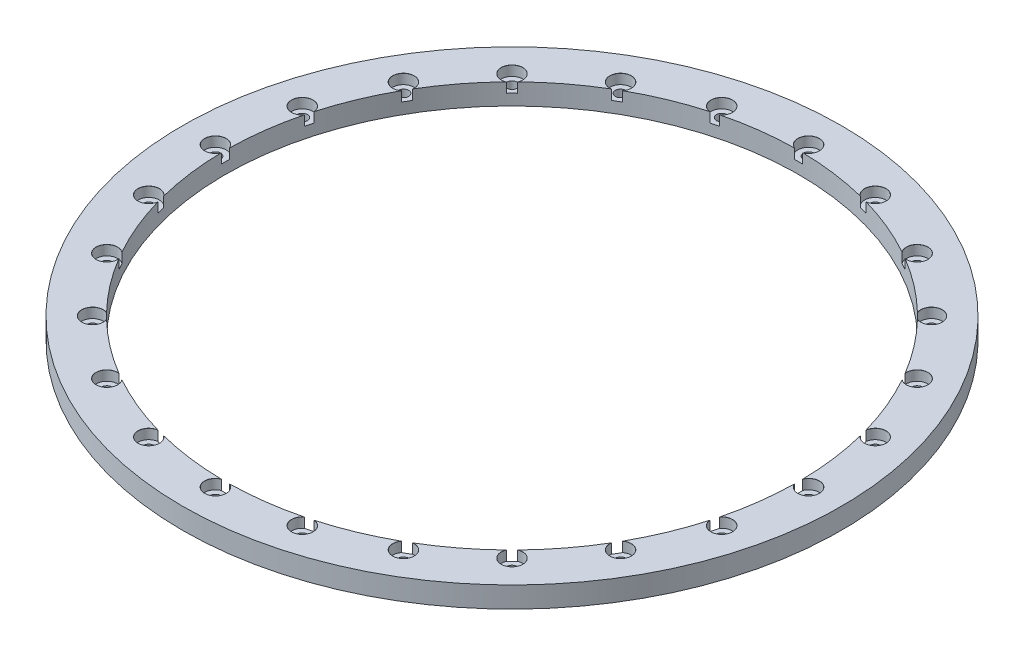
from build123d import *

# Parameters (mm, degrees)
SKETCH1_R                      = 100
SKETCH1_R_2                    = 87
BOSS_EXTRUDE1_DEPTH            = 6.35
CBORE_FOR_M3_SHCS1_AT_2_COUNT  = 2
CBORE_FOR_M3_SHCS1_AT_2_PITCH  = 23.4947146
CBORE_FOR_M3_SHCS1_AT_3_COUNT  = 2
CBORE_FOR_M3_SHCS1_AT_3_PITCH  = 46.587428118
CBORE_FOR_M3_SHCS1_AT_4_COUNT  = 2
CBORE_FOR_M3_SHCS1_AT_4_PITCH  = 68.883017826
CBORE_FOR_M3_SHCS1_AT_5_COUNT  = 2
CBORE_FOR_M3_SHCS1_AT_5_PITCH  = 90
CBORE_FOR_M3_SHCS1_AT_6_COUNT  = 2
CBORE_FOR_M3_SHCS1_AT_6_PITCH  = 109.577057222
CBORE_FOR_M3_SHCS1_AT_7_COUNT  = 2
CBORE_FOR_M3_SHCS1_AT_7_PITCH  = 127.279220614
CBORE_FOR_M3_SHCS1_AT_8_COUNT  = 2
CBORE_FOR_M3_SHCS1_AT_8_PITCH  = 142.803601252
CBORE_FOR_M3_SHCS1_AT_9_COUNT  = 2
CBORE_FOR_M3_SHCS1_AT_9_PITCH  = 155.884572681
CBORE_FOR_M3_SHCS1_AT_10_COUNT = 2
CBORE_FOR_M3_SHCS1_AT_10_PITCH = 166.298315852
CBORE_FOR_M3_SHCS1_AT_11_COUNT = 2
CBORE_FOR_M3_SHCS1_AT_11_PITCH = 173.866648732
CBORE_FOR_M3_SHCS1_AT_12_COUNT = 2
CBORE_FOR_M3_SHCS1_AT_12_PITCH = 178.460075047
CBORE_FOR_M3_SHCS1_AT_13_COUNT = 2
CBORE_FOR_M3_SHCS1_AT_13_PITCH = 180
CBORE_FOR_M3_SHCS1_AT_14_COUNT = 2
CBORE_FOR_M3_SHCS1_AT_14_PITCH = 178.460075047
CBORE_FOR_M3_SHCS1_AT_15_COUNT = 2
CBORE_FOR_M3_SHCS1_AT_15_PITCH = 173.866648732
CBORE_FOR_M3_SHCS1_AT_16_COUNT = 2
CBORE_FOR_M3_SHCS1_AT_16_PITCH = 166.298315852
CBORE_FOR_M3_SHCS1_AT_17_COUNT = 2
CBORE_FOR_M3_SHCS1_AT_17_PITCH = 155.884572681
CBORE_FOR_M3_SHCS1_AT_18_COUNT = 2
CBORE_FOR_M3_SHCS1_AT_18_PITCH = 142.803601252
CBORE_FOR_M3_SHCS1_AT_19_COUNT = 2
CBORE_FOR_M3_SHCS1_AT_19_PITCH = 127.279220614
CBORE_FOR_M3_SHCS1_AT_20_COUNT = 2
CBORE_FOR_M3_SHCS1_AT_20_PITCH = 109.577057222
CBORE_FOR_M3_SHCS1_AT_21_COUNT = 2
CBORE_FOR_M3_SHCS1_AT_21_PITCH = 90
CBORE_FOR_M3_SHCS1_AT_22_COUNT = 2
CBORE_FOR_M3_SHCS1_AT_22_PITCH = 68.883017826
CBORE_FOR_M3_SHCS1_AT_23_COUNT = 2
CBORE_FOR_M3_SHCS1_AT_23_PITCH = 46.587428118
CBORE_FOR_M3_SHCS1_AT_24_COUNT = 2
CBORE_FOR_M3_SHCS1_AT_24_PITCH = 23.4947146


with BuildPart() as part:
    # Sketch1 → Boss-Extrude1 (new body)
    with BuildSketch(Plane(origin=(0, 0, 0), x_dir=(1, 0, 0), z_dir=(0, 1, 0))):
        Circle(SKETCH1_R)
        Circle(SKETCH1_R_2, mode=Mode.SUBTRACT)
    extrude(amount=BOSS_EXTRUDE1_DEPTH)

    # Sketch3 → CBORE for M3 SHCS1 (revolve, cut)
    with BuildSketch(Plane(origin=(90, 6.35, 0), x_dir=(0, 0, 1), z_dir=(1, 0, 0))):
        Polygon((0, 0), (0, 6.35), (1.6, 6.35), (1.6, 3), (3.25, 3), (3.25, 0.025), (3.275, 0), align=None)
    cbore_for_m3_shcs1 = revolve(axis=Axis((90, 12.7, 0), (0, -1, 0)), mode=Mode.SUBTRACT)

    # CBORE for M3 SHCS1 at 2: CBORE for M3 SHCS1 ×2
    with Locations(*[Vector(-0.13052619222005138, 0, 0.9914448613738105) * (i * CBORE_FOR_M3_SHCS1_AT_2_PITCH) for i in range(1, CBORE_FOR_M3_SHCS1_AT_2_COUNT)]):
        add(cbore_for_m3_shcs1, mode=Mode.SUBTRACT)

    # CBORE for M3 SHCS1 at 3: CBORE for M3 SHCS1 ×2
    with Locations(*[Vector(-0.25881904510252074, 0, 0.9659258262890683) * (i * CBORE_FOR_M3_SHCS1_AT_3_PITCH) for i in range(1, CBORE_FOR_M3_SHCS1_AT_3_COUNT)]):
        add(cbore_for_m3_shcs1, mode=Mode.SUBTRACT)

    # CBORE for M3 SHCS1 at 4: CBORE for M3 SHCS1 ×2
    with Locations(*[Vector(-0.3826834323650899, 0, 0.9238795325112867) * (i * CBORE_FOR_M3_SHCS1_AT_4_PITCH) for i in range(1, CBORE_FOR_M3_SHCS1_AT_4_COUNT)]):
        add(cbore_for_m3_shcs1, mode=Mode.SUBTRACT)

    # CBORE for M3 SHCS1 at 5: CBORE for M3 SHCS1 ×2
    with Locations(*[Vector(-0.5000000000000001, 0, 0.8660254037844386) * (i * CBORE_FOR_M3_SHCS1_AT_5_PITCH) for i in range(1, CBORE_FOR_M3_SHCS1_AT_5_COUNT)]):
        add(cbore_for_m3_shcs1, mode=Mode.SUBTRACT)

    # CBORE for M3 SHCS1 at 6: CBORE for M3 SHCS1 ×2
    with Locations(*[Vector(-0.6087614290087208, 0, 0.7933533402912352) * (i * CBORE_FOR_M3_SHCS1_AT_6_PITCH) for i in range(1, CBORE_FOR_M3_SHCS1_AT_6_COUNT)]):
        add(cbore_for_m3_shcs1, mode=Mode.SUBTRACT)

    # CBORE for M3 SHCS1 at 7: CBORE for M3 SHCS1 ×2
    with Locations(*[Vector(-0.7071067811865476, 0, 0.7071067811865475) * (i * CBORE_FOR_M3_SHCS1_AT_7_PITCH) for i in range(1, CBORE_FOR_M3_SHCS1_AT_7_COUNT)]):
        add(cbore_for_m3_shcs1, mode=Mode.SUBTRACT)

    # CBORE for M3 SHCS1 at 8: CBORE for M3 SHCS1 ×2
    with Locations(*[Vector(-0.7933533402912352, 0, 0.6087614290087207) * (i * CBORE_FOR_M3_SHCS1_AT_8_PITCH) for i in range(1, CBORE_FOR_M3_SHCS1_AT_8_COUNT)]):
        add(cbore_for_m3_shcs1, mode=Mode.SUBTRACT)

    # CBORE for M3 SHCS1 at 9: CBORE for M3 SHCS1 ×2
    with Locations(*[Vector(-0.8660254037844387, 0, 0.5000000000000001) * (i * CBORE_FOR_M3_SHCS1_AT_9_PITCH) for i in range(1, CBORE_FOR_M3_SHCS1_AT_9_COUNT)]):
        add(cbore_for_m3_shcs1, mode=Mode.SUBTRACT)

    # CBORE for M3 SHCS1 at 10: CBORE for M3 SHCS1 ×2
    with Locations(*[Vector(-0.9238795325112868, 0, 0.38268343236508967) * (i * CBORE_FOR_M3_SHCS1_AT_10_PITCH) for i in range(1, CBORE_FOR_M3_SHCS1_AT_10_COUNT)]):
        add(cbore_for_m3_shcs1, mode=Mode.SUBTRACT)

    # CBORE for M3 SHCS1 at 11: CBORE for M3 SHCS1 ×2
    with Locations(*[Vector(-0.9659258262890683, 0, 0.2588190451025209) * (i * CBORE_FOR_M3_SHCS1_AT_11_PITCH) for i in range(1, CBORE_FOR_M3_SHCS1_AT_11_COUNT)]):
        add(cbore_for_m3_shcs1, mode=Mode.SUBTRACT)

    # CBORE for M3 SHCS1 at 12: CBORE for M3 SHCS1 ×2
    with Locations(*[Vector(-0.9914448613738104, 0, 0.1305261922200516) * (i * CBORE_FOR_M3_SHCS1_AT_12_PITCH) for i in range(1, CBORE_FOR_M3_SHCS1_AT_12_COUNT)]):
        add(cbore_for_m3_shcs1, mode=Mode.SUBTRACT)

    # CBORE for M3 SHCS1 at 13: CBORE for M3 SHCS1 ×2
    with Locations(*[(-i * CBORE_FOR_M3_SHCS1_AT_13_PITCH, 0, 0) for i in range(1, CBORE_FOR_M3_SHCS1_AT_13_COUNT)]):
        add(cbore_for_m3_shcs1, mode=Mode.SUBTRACT)

    # CBORE for M3 SHCS1 at 14: CBORE for M3 SHCS1 ×2
    with Locations(*[Vector(-0.9914448613738105, 0, -0.13052619222005152) * (i * CBORE_FOR_M3_SHCS1_AT_14_PITCH) for i in range(1, CBORE_FOR_M3_SHCS1_AT_14_COUNT)]):
        add(cbore_for_m3_shcs1, mode=Mode.SUBTRACT)

    # CBORE for M3 SHCS1 at 15: CBORE for M3 SHCS1 ×2
    with Locations(*[Vector(-0.9659258262890683, 0, -0.25881904510252074) * (i * CBORE_FOR_M3_SHCS1_AT_15_PITCH) for i in range(1, CBORE_FOR_M3_SHCS1_AT_15_COUNT)]):
        add(cbore_for_m3_shcs1, mode=Mode.SUBTRACT)

    # CBORE for M3 SHCS1 at 16: CBORE for M3 SHCS1 ×2
    with Locations(*[Vector(-0.9238795325112868, 0, -0.3826834323650895) * (i * CBORE_FOR_M3_SHCS1_AT_16_PITCH) for i in range(1, CBORE_FOR_M3_SHCS1_AT_16_COUNT)]):
        add(cbore_for_m3_shcs1, mode=Mode.SUBTRACT)

    # CBORE for M3 SHCS1 at 17: CBORE for M3 SHCS1 ×2
    with Locations(*[Vector(-0.8660254037844387, 0, -0.49999999999999994) * (i * CBORE_FOR_M3_SHCS1_AT_17_PITCH) for i in range(1, CBORE_FOR_M3_SHCS1_AT_17_COUNT)]):
        add(cbore_for_m3_shcs1, mode=Mode.SUBTRACT)

    # CBORE for M3 SHCS1 at 18: CBORE for M3 SHCS1 ×2
    with Locations(*[Vector(-0.7933533402912353, 0, -0.6087614290087204) * (i * CBORE_FOR_M3_SHCS1_AT_18_PITCH) for i in range(1, CBORE_FOR_M3_SHCS1_AT_18_COUNT)]):
        add(cbore_for_m3_shcs1, mode=Mode.SUBTRACT)

    # CBORE for M3 SHCS1 at 19: CBORE for M3 SHCS1 ×2
    with Locations(*[Vector(-0.7071067811865475, 0, -0.7071067811865476) * (i * CBORE_FOR_M3_SHCS1_AT_19_PITCH) for i in range(1, CBORE_FOR_M3_SHCS1_AT_19_COUNT)]):
        add(cbore_for_m3_shcs1, mode=Mode.SUBTRACT)

    # CBORE for M3 SHCS1 at 20: CBORE for M3 SHCS1 ×2
    with Locations(*[Vector(-0.6087614290087208, 0, -0.793353340291235) * (i * CBORE_FOR_M3_SHCS1_AT_20_PITCH) for i in range(1, CBORE_FOR_M3_SHCS1_AT_20_COUNT)]):
        add(cbore_for_m3_shcs1, mode=Mode.SUBTRACT)

    # CBORE for M3 SHCS1 at 21: CBORE for M3 SHCS1 ×2
    with Locations(*[Vector(-0.5000000000000003, 0, -0.8660254037844386) * (i * CBORE_FOR_M3_SHCS1_AT_21_PITCH) for i in range(1, CBORE_FOR_M3_SHCS1_AT_21_COUNT)]):
        add(cbore_for_m3_shcs1, mode=Mode.SUBTRACT)

    # CBORE for M3 SHCS1 at 22: CBORE for M3 SHCS1 ×2
    with Locations(*[Vector(-0.3826834323650898, 0, -0.9238795325112868) * (i * CBORE_FOR_M3_SHCS1_AT_22_PITCH) for i in range(1, CBORE_FOR_M3_SHCS1_AT_22_COUNT)]):
        add(cbore_for_m3_shcs1, mode=Mode.SUBTRACT)

    # CBORE for M3 SHCS1 at 23: CBORE for M3 SHCS1 ×2
    with Locations(*[Vector(-0.2588190451025208, 0, -0.9659258262890683) * (i * CBORE_FOR_M3_SHCS1_AT_23_PITCH) for i in range(1, CBORE_FOR_M3_SHCS1_AT_23_COUNT)]):
        add(cbore_for_m3_shcs1, mode=Mode.SUBTRACT)

    # CBORE for M3 SHCS1 at 24: CBORE for M3 SHCS1 ×2
    with Locations(*[Vector(-0.13052619222005138, 0, -0.9914448613738105) * (i * CBORE_FOR_M3_SHCS1_AT_24_PITCH) for i in range(1, CBORE_FOR_M3_SHCS1_AT_24_COUNT)]):
        add(cbore_for_m3_shcs1, mode=Mode.SUBTRACT)


solid = part.part
